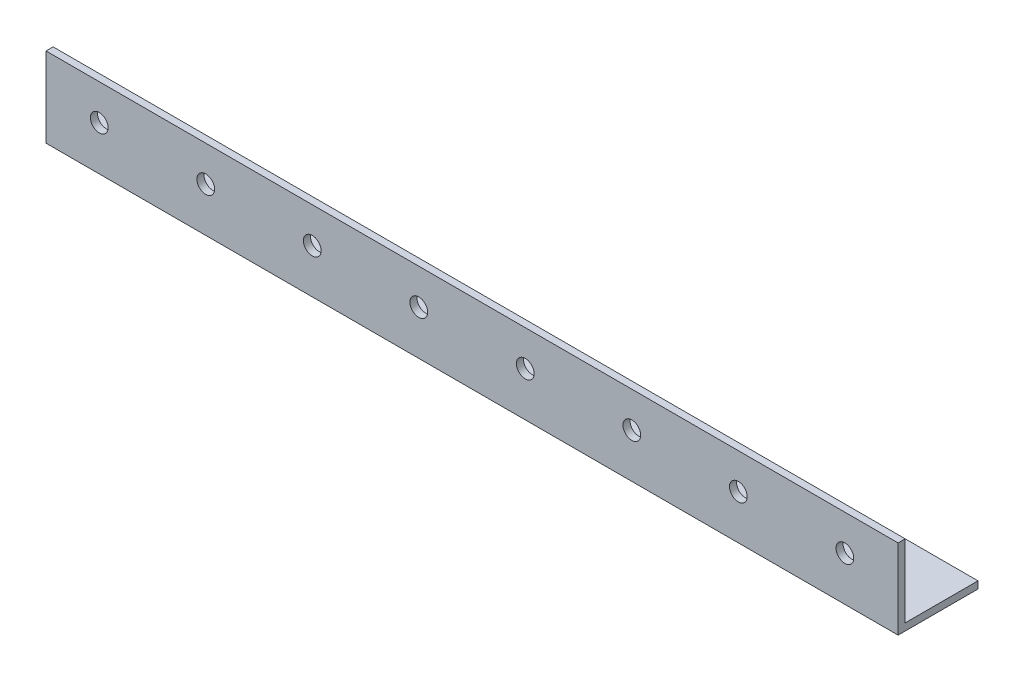
from build123d import *

# Parameters (mm, degrees)
EXTRUDE_1_DEPTH     = 480
SKETCH_2_R          = 5
CUT_EXTRUDE_1_DEPTH = 485.200371747


with BuildPart() as part:
    # Эскиз1 → Вытянуть-Тонкостенный1 (new body)
    with BuildSketch(Plane(origin=(0, 0, 0), x_dir=(0, 0, -1), z_dir=(1, 0, 0))):
        Polygon((45, 0), (0, 0), (0, 45), (4, 45), (4, 4), (45, 4), align=None)
    extrude(amount=EXTRUDE_1_DEPTH)

    # Эскиз2 → Вырез-Вытянуть1 (cut, through all)
    with BuildSketch(Plane.XY):
        with Locations((30, 25)):
            Circle(SKETCH_2_R)
        with Locations((90, 25)):
            Circle(SKETCH_2_R)
        with Locations((150, 25)):
            Circle(SKETCH_2_R)
        with Locations((210, 25)):
            Circle(SKETCH_2_R)
        with Locations((270, 25)):
            Circle(SKETCH_2_R)
        with Locations((330, 25)):
            Circle(SKETCH_2_R)
        with Locations((390, 25)):
            Circle(SKETCH_2_R)
        with Locations((450, 25)):
            Circle(SKETCH_2_R)
    extrude(amount=-CUT_EXTRUDE_1_DEPTH, mode=Mode.SUBTRACT)


solid = part.part
